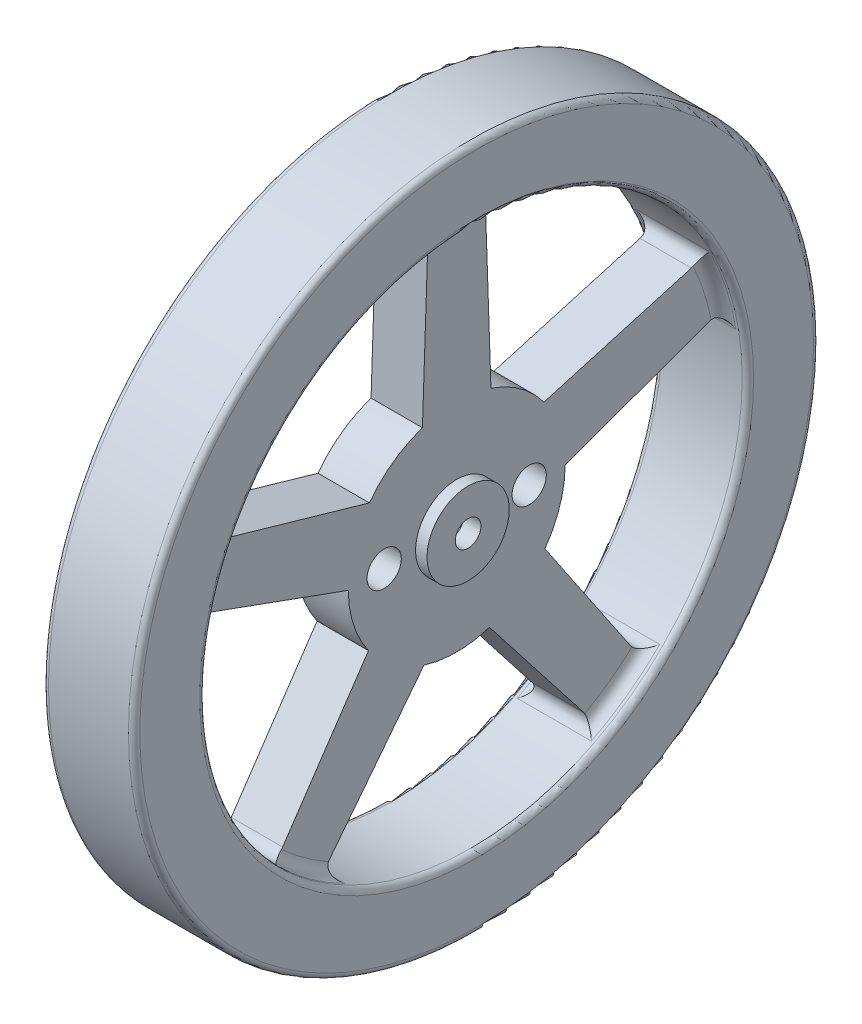
from build123d import *

# Parameters (mm, degrees)
SKETCH1_R           = 30
SKETCH1_R_2         = 23.75
BOSS_EXTRUDE1_DEPTH = 4
SKETCH3_R           = 9.5
SKETCH3_R_2         = 1.125
BOSS_EXTRUDE2_DEPTH = 2.25
FILLET1_R           = 1
CIRPATTERN1_START   = -3.2500001
CIRPATTERN1_DEPTH   = 6.5000002
SKETCH4_R           = 3.6
SKETCH4_R_2         = 1.125
BOSS_EXTRUDE3_DEPTH = 1
SKETCH5_R           = 1.5
CUT_EXTRUDE1_DEPTH  = 43.884291996
CIRPATTERN2_COUNT   = 2
SKETCH6_R           = 1.125
CUT_EXTRUDE2_DEPTH  = 4
FILLET2_R           = 0.5


with BuildPart() as part:
    # Sketch1 → Boss-Extrude1 (new, symmetric)
    with BuildSketch(Plane(origin=(0, 0, 0), x_dir=(0, 0, -1), z_dir=(1, 0, 0))):
        Circle(SKETCH1_R)
        Circle(SKETCH1_R_2, mode=Mode.SUBTRACT)
    extrude(amount=BOSS_EXTRUDE1_DEPTH, both=True)

    # Sketch3 → Boss-Extrude2 (add, symmetric)
    # profile 1 of 2: a face of its own
    with BuildSketch(Plane(origin=(0, 0, 0), x_dir=(0, 0, -1), z_dir=(1, 0, 0))):
        Circle(SKETCH3_R)
        Circle(SKETCH3_R_2, mode=Mode.SUBTRACT)
    # profile 2 of 2: a face of its own
    with BuildSketch(Plane(origin=(0, 0, 0), x_dir=(0, 0, -1), z_dir=(1, 0, 0))):
        with BuildLine():
            Line((-2.5, 23.618054535), (-3, 9.013878189))
            ThreePointArc((-3, 9.013878189), (0, 9.5), (3, 9.013878189))
            Line((3, 9.013878189), (2.5, 23.618054535))
            ThreePointArc((2.5, 23.618054535), (0, 23.75), (-2.5, 23.618054535))
        make_face()
    extrude(amount=BOSS_EXTRUDE2_DEPTH, both=True)

    # Fillet1
    # the kernel refuses this fillet: 1 mm, written as the material it adds along each edge
    with BuildSketch(Plane(origin=(2.25, 0, 0), x_dir=(0, 0.9778800585979858, -0.2091664193803582), z_dir=(0, -0.2091664193803582, -0.9778800585979858))) as fillet1_piece_1_section:
        with BuildLine():
            CenterArc((23.75 - FILLET1_R, FILLET1_R), FILLET1_R, 270, 90)
            Line((23.75 - FILLET1_R, 0), (23.75, 0))
            Line((23.75, 0), (23.75, FILLET1_R))
        make_face()
    fillet1_piece_1 = revolve(axis=Axis((2.25, 0, 0), (1, 0, 0)), revolution_arc=24.147013547, mode=Mode.PRIVATE)
    fillet1_piece_1 = split(fillet1_piece_1, bisect_by=Plane(origin=(2.25, 0.113143406, -3.304732515), z_dir=(0, -0.03421673405052404, 0.9994144361129249)), keep=Keep.TOP, mode=Mode.PRIVATE)
    fillet1_piece_1 = split(fillet1_piece_1, bisect_by=Plane(origin=(2.25, 0.113143406, 3.304732515), z_dir=(0, -0.03421673405052404, -0.9994144361129249)), keep=Keep.TOP, mode=Mode.PRIVATE)
    add(fillet1_piece_1)
    with BuildSketch(Plane(origin=(2.25, 23.618054535, -2.5), x_dir=(0, -0.13047123096448623, -0.9914520956105806), z_dir=(-1, 0, 0)), Plane(origin=(-2.25, 23.618054535, 2.5), x_dir=(0, -0.13047123096448424, 0.9914520956105807), z_dir=(1, 0, 0))) as fillet1_piece_2:
        with BuildLine():
            CenterArc((1.180309811, 0.9996778), FILLET1_R, 170.542319009, 100.912176362)
            Line((0.193902574, 1.163996884), (0, 0))
            ThreePointArc((0, 0), (0.602846409, -0.00765226), (1.205692818, 0))
        make_face()
    extrude(amount=4.5)
    with BuildSketch(Plane(origin=(-2.25, 0, 0), x_dir=(0, 0.9778800585979858, -0.2091664193803582), z_dir=(0, -0.2091664193803582, -0.9778800585979858))) as fillet1_piece_3_section:
        with BuildLine():
            CenterArc((23.75 - FILLET1_R, -FILLET1_R), FILLET1_R, 0, 90)
            Line((23.75 - FILLET1_R, 0), (23.75, 0))
            Line((23.75, 0), (23.75, -FILLET1_R))
        make_face()
    fillet1_piece_3 = revolve(axis=Axis((-2.25, 0, 0), (1, 0, 0)), revolution_arc=24.147013547, mode=Mode.PRIVATE)
    fillet1_piece_3 = split(fillet1_piece_3, bisect_by=Plane(origin=(-2.25, 0.113143406, 3.304732515), z_dir=(0, -0.03421673405052404, -0.9994144361129249)), keep=Keep.TOP, mode=Mode.PRIVATE)
    fillet1_piece_3 = split(fillet1_piece_3, bisect_by=Plane(origin=(-2.25, 0.113143406, -3.304732515), z_dir=(0, -0.03421673405052404, 0.9994144361129249)), keep=Keep.TOP, mode=Mode.PRIVATE)
    add(fillet1_piece_3)
    with BuildSketch(Plane(origin=(2.25, 0, 0), x_dir=(0, 0.9778800585979858, -0.2091664193803582), z_dir=(0, -0.2091664193803582, -0.9778800585979858))) as fillet1_piece_4a_section:
        with BuildLine():
            CenterArc((23.75 - FILLET1_R, FILLET1_R), FILLET1_R, 270, 90)
            Line((23.75 - FILLET1_R, 0), (23.75, 0))
            Line((23.75, 0), (23.75, FILLET1_R))
        make_face()
    fillet1_piece_4a = revolve(axis=Axis((2.25, 0, 0), (1, 0, 0)), revolution_arc=24.147013547, mode=Mode.PRIVATE)
    fillet1_piece_4a = split(fillet1_piece_4a, bisect_by=Plane(origin=(2.25, 0.113143406, -3.304732515), z_dir=(0, 0.03421673405052404, -0.9994144361129249)), keep=Keep.TOP, mode=Mode.PRIVATE)
    with BuildSketch(Plane(origin=(5.264232045, 23.618054535, -2.5), x_dir=(0, -0.13047123096448623, -0.9914520956105806), z_dir=(-1, 0, 0))) as fillet1_piece_4b_section:
        with BuildLine():
            CenterArc((1.180309811, 0.9996778), FILLET1_R, 170.542319009, 100.912176362)
            Line((0.193902574, 1.163996884), (0, 0))
            ThreePointArc((0, 0), (0.602846409, -0.00765226), (1.205692818, 0))
        make_face()
    fillet1_piece_4b = extrude(amount=7.514232045, mode=Mode.PRIVATE)
    fillet1_piece_4b = split(fillet1_piece_4b, bisect_by=Plane(origin=(4, 23.618054535, -2.5), z_dir=(-1, 0, 0)), keep=Keep.TOP, mode=Mode.PRIVATE)
    fillet1_piece_4b = split(fillet1_piece_4b, bisect_by=Plane(origin=(2.25, 23.618054535, -2.5), z_dir=(1, 0, 0)), keep=Keep.TOP, mode=Mode.PRIVATE)
    fillet1_piece_4 = fillet1_piece_4a & fillet1_piece_4b
    add(fillet1_piece_4)
    with BuildSketch(Plane(origin=(2.25, 0, 0), x_dir=(0, 0.9778800585979858, -0.2091664193803582), z_dir=(0, -0.2091664193803582, -0.9778800585979858))) as fillet1_piece_5a_section:
        with BuildLine():
            CenterArc((23.75 - FILLET1_R, FILLET1_R), FILLET1_R, 270, 90)
            Line((23.75 - FILLET1_R, 0), (23.75, 0))
            Line((23.75, 0), (23.75, FILLET1_R))
        make_face()
    fillet1_piece_5a = revolve(axis=Axis((2.25, 0, 0), (1, 0, 0)), revolution_arc=24.147013547, mode=Mode.PRIVATE)
    fillet1_piece_5a = split(fillet1_piece_5a, bisect_by=Plane(origin=(2.25, 0.113143406, 3.304732515), z_dir=(0, 0.03421673405052404, 0.9994144361129249)), keep=Keep.TOP, mode=Mode.PRIVATE)
    with BuildSketch(Plane(origin=(-2.25, 23.618054535, 2.5), x_dir=(0, -0.13047123096448424, 0.9914520956105807), z_dir=(1, 0, 0))) as fillet1_piece_5b_section:
        with BuildLine():
            CenterArc((1.180309811, 0.9996778), FILLET1_R, 170.542319009, 100.912176362)
            Line((0.193902574, 1.163996884), (0, 0))
            ThreePointArc((0, 0), (0.602846409, -0.00765226), (1.205692818, 0))
        make_face()
    fillet1_piece_5b = extrude(amount=7.514232045, mode=Mode.PRIVATE)
    fillet1_piece_5b = split(fillet1_piece_5b, bisect_by=Plane(origin=(4, 23.618054535, 2.5), z_dir=(-1, 0, 0)), keep=Keep.TOP, mode=Mode.PRIVATE)
    fillet1_piece_5b = split(fillet1_piece_5b, bisect_by=Plane(origin=(2.25, 23.618054535, 2.5), z_dir=(1, 0, 0)), keep=Keep.TOP, mode=Mode.PRIVATE)
    fillet1_piece_5 = fillet1_piece_5a & fillet1_piece_5b
    add(fillet1_piece_5)
    with BuildSketch(Plane(origin=(-2.25, 0, 0), x_dir=(0, 0.9778800585979858, -0.2091664193803582), z_dir=(0, -0.2091664193803582, -0.9778800585979858))) as fillet1_piece_6a_section:
        with BuildLine():
            CenterArc((23.75 - FILLET1_R, -FILLET1_R), FILLET1_R, 0, 90)
            Line((23.75 - FILLET1_R, 0), (23.75, 0))
            Line((23.75, 0), (23.75, -FILLET1_R))
        make_face()
    fillet1_piece_6a = revolve(axis=Axis((-2.25, 0, 0), (1, 0, 0)), revolution_arc=24.147013547, mode=Mode.PRIVATE)
    fillet1_piece_6a = split(fillet1_piece_6a, bisect_by=Plane(origin=(-2.25, 0.113143406, -3.304732515), z_dir=(0, 0.03421673405052404, -0.9994144361129249)), keep=Keep.TOP, mode=Mode.PRIVATE)
    with BuildSketch(Plane(origin=(2.25, 23.618054535, -2.5), x_dir=(0, -0.13047123096448623, -0.9914520956105806), z_dir=(-1, 0, 0))) as fillet1_piece_6b_section:
        with BuildLine():
            CenterArc((1.180309811, 0.9996778), FILLET1_R, 170.542319009, 100.912176362)
            Line((0.193902574, 1.163996884), (0, 0))
            ThreePointArc((0, 0), (0.602846409, -0.00765226), (1.205692818, 0))
        make_face()
    fillet1_piece_6b = extrude(amount=7.514232045, mode=Mode.PRIVATE)
    fillet1_piece_6b = split(fillet1_piece_6b, bisect_by=Plane(origin=(-4, 23.618054535, -2.5), z_dir=(1, 0, 0)), keep=Keep.TOP, mode=Mode.PRIVATE)
    fillet1_piece_6b = split(fillet1_piece_6b, bisect_by=Plane(origin=(-2.25, 23.618054535, -2.5), z_dir=(-1, 0, 0)), keep=Keep.TOP, mode=Mode.PRIVATE)
    fillet1_piece_6 = fillet1_piece_6a & fillet1_piece_6b
    add(fillet1_piece_6)
    with BuildSketch(Plane(origin=(-5.264232045, 23.618054535, 2.5), x_dir=(0, -0.13047123096448424, 0.9914520956105807), z_dir=(1, 0, 0))) as fillet1_piece_7a_section:
        with BuildLine():
            CenterArc((1.180309811, 0.9996778), FILLET1_R, 170.542319009, 100.912176362)
            Line((0.193902574, 1.163996884), (0, 0))
            ThreePointArc((0, 0), (0.602846409, -0.00765226), (1.205692818, 0))
        make_face()
    fillet1_piece_7a = extrude(amount=7.514232045, mode=Mode.PRIVATE)
    fillet1_piece_7a = split(fillet1_piece_7a, bisect_by=Plane(origin=(-4, 23.618054535, 2.5), z_dir=(1, 0, 0)), keep=Keep.TOP, mode=Mode.PRIVATE)
    fillet1_piece_7a = split(fillet1_piece_7a, bisect_by=Plane(origin=(-2.25, 23.618054535, 2.5), z_dir=(-1, 0, 0)), keep=Keep.TOP, mode=Mode.PRIVATE)
    with BuildSketch(Plane(origin=(-2.25, 0, 0), x_dir=(0, 0.9778800585979858, -0.2091664193803582), z_dir=(0, -0.2091664193803582, -0.9778800585979858))) as fillet1_piece_7b_section:
        with BuildLine():
            CenterArc((23.75 - FILLET1_R, -FILLET1_R), FILLET1_R, 0, 90)
            Line((23.75 - FILLET1_R, 0), (23.75, 0))
            Line((23.75, 0), (23.75, -FILLET1_R))
        make_face()
    fillet1_piece_7b = revolve(axis=Axis((-2.25, 0, 0), (1, 0, 0)), revolution_arc=24.147013547, mode=Mode.PRIVATE)
    fillet1_piece_7b = split(fillet1_piece_7b, bisect_by=Plane(origin=(-2.25, 0.113143406, 3.304732515), z_dir=(0, 0.03421673405052404, 0.9994144361129249)), keep=Keep.TOP, mode=Mode.PRIVATE)
    fillet1_piece_7 = fillet1_piece_7a & fillet1_piece_7b
    add(fillet1_piece_7)

    # CirPattern1: read off the stored shape, not the designer's step
    # CirPattern1 outline → CirPattern1 (add)
    with BuildSketch(Plane.YZ.offset(CIRPATTERN1_START)):
        with BuildLine():
            ThreePointArc((-16.808048677, -16.779511306), (-17.095729582, -15.977076963), (-16.660100512, -15.244350212))
            Line((-16.660100512, -15.244350212), (-5.529024883, -7.725275648))
            ThreePointArc((-5.529024883, -7.725275648), (-7.685661447, -5.583959897), (-9.055736397, -2.871173682))
            Line((-9.055736397, -2.871173682), (-19.646492792, -11.13393387))
            ThreePointArc((-19.646492792, -11.13393387), (-20.477974129, -11.321816718), (-21.152236251, -10.80025007))
            ThreePointArc((-21.152236251, -10.80025007), (-19.214153616, -13.959899742), (-16.808048677, -16.779511306))
        make_face()
        with BuildLine():
            ThreePointArc((5.638611094, -7.645656606), (2.935661447, -9.035036905), (-0.067728003, -9.499758572))
            Line((-0.067728003, -9.499758572), (4.517900207, -22.125499772))
            ThreePointArc((4.517900207, -22.125499772), (4.43964555, -22.974344509), (3.735247736, -23.454432936))
            ThreePointArc((3.735247736, -23.454432936), (7.339153616, -22.587592262), (10.764290884, -21.170558372))
            ThreePointArc((10.764290884, -21.170558372), (9.912232184, -21.196193321), (9.349984419, -20.555460437))
            Line((9.349984419, -20.555460437), (5.638611094, -7.645656606))
        make_face()
        with BuildLine():
            Line((-19.646492792, 11.13393387), (-9.055736397, 2.871173682))
            ThreePointArc((-9.055736397, 2.871173682), (-7.685661447, 5.583959897), (-5.529024883, 7.725275648))
            Line((-5.529024883, 7.725275648), (-16.660100512, 15.244350212))
            ThreePointArc((-16.660100512, 15.244350212), (-17.095729582, 15.977076963), (-16.808048677, 16.779511306))
            ThreePointArc((-16.808048677, 16.779511306), (-19.214153616, 13.959899742), (-21.152236251, 10.80025007))
            ThreePointArc((-21.152236251, 10.80025007), (-20.477974129, 11.321816718), (-19.646492792, 11.13393387))
        make_face()
        with BuildLine():
            Line((4.517900207, 22.125499772), (-0.067728003, 9.499758572))
            ThreePointArc((-0.067728003, 9.499758572), (2.935661447, 9.035036905), (5.638611094, 7.645656606))
            Line((5.638611094, 7.645656606), (9.349984419, 20.555460437))
            ThreePointArc((9.349984419, 20.555460437), (9.912232184, 21.196193321), (10.764290884, 21.170558372))
            ThreePointArc((10.764290884, 21.170558372), (7.339153616, 22.587592262), (3.735247736, 23.454432936))
            ThreePointArc((3.735247736, 23.454432936), (4.43964555, 22.974344509), (4.517900207, 22.125499772))
        make_face()
    extrude(amount=CIRPATTERN1_DEPTH)

    # CirPattern1 2 outline → CirPattern1 2 (revolve, cut)
    with BuildSketch(Plane.YX):
        with BuildLine():
            Line((9.5, 3.2500001), (9.5, 2.25))
            Line((9.5, 2.25), (22.75, 2.25))
            ThreePointArc((22.75, 2.25), (23.457106781, 2.542893219), (23.75, 3.25))
            Line((23.75, 3.25), (9.5, 3.2500001))
        make_face()
        with BuildLine():
            Line((22.75, -2.25), (9.5, -2.25))
            Line((9.5, -2.25), (9.5, -3.2500001))
            Line((9.5, -3.2500001), (23.75, -3.25))
            ThreePointArc((23.75, -3.25), (23.457106781, -2.542893219), (22.75, -2.25))
        make_face()
    revolve(axis=Axis((0, 0, 0), (1, 0, 0)), mode=Mode.SUBTRACT)

    # Sketch4 → Boss-Extrude3 (add)
    with BuildSketch(Plane(origin=(2.25, 0, 0), x_dir=(0, 0, -1), z_dir=(1, 0, 0))):
        Circle(SKETCH4_R)
        Circle(SKETCH4_R_2, mode=Mode.SUBTRACT)
    extrude(amount=BOSS_EXTRUDE3_DEPTH)

    # Sketch5 → Cut-Extrude1 (cut, through all)
    with BuildSketch(Plane(origin=(2.25, 0, 0), x_dir=(0, 0, -1), z_dir=(1, 0, 0))):
        with Locations((-6.35, 0)):
            Circle(SKETCH5_R)
    cut_extrude1 = extrude(amount=-CUT_EXTRUDE1_DEPTH, mode=Mode.SUBTRACT)

    # CirPattern2: Cut-Extrude1 ×2 about axis
    cirpattern2_axis = Axis((0, 0, 0), (1, 0, 0))
    for i in range(1, CIRPATTERN2_COUNT):
        add(cut_extrude1.rotate(cirpattern2_axis, i * 360 / CIRPATTERN2_COUNT), mode=Mode.SUBTRACT)

    # Sketch6 → Cut-Extrude2 (cut)
    with BuildSketch(Plane.ZY.offset(2.25)):
        with BuildLine():
            Line((2.011684617, 1.875), (-2.011684617, 1.875))
            ThreePointArc((-2.011684617, 1.875), (-2.75, 0), (-2.011684617, -1.875))
            Line((-2.011684617, -1.875), (2.011684617, -1.875))
            ThreePointArc((2.011684617, -1.875), (2.55877243, -1.007563224), (2.75, 0))
            ThreePointArc((2.75, 0), (2.55877243, 1.007563224), (2.011684617, 1.875))
        make_face()
        Circle(SKETCH6_R, mode=Mode.SUBTRACT)
    extrude(amount=-CUT_EXTRUDE2_DEPTH, mode=Mode.SUBTRACT)

    # Fillet2
    fillet2_edges = [part.edges().sort_by_distance(p)[0] for p in [
        (-4, 0, 30),
        (4, 0, 30),
        (-4, 0, 23.75),
        (4, 0, 23.75),
    ]]
    fillet(fillet2_edges, radius=FILLET2_R)


solid = part.part
